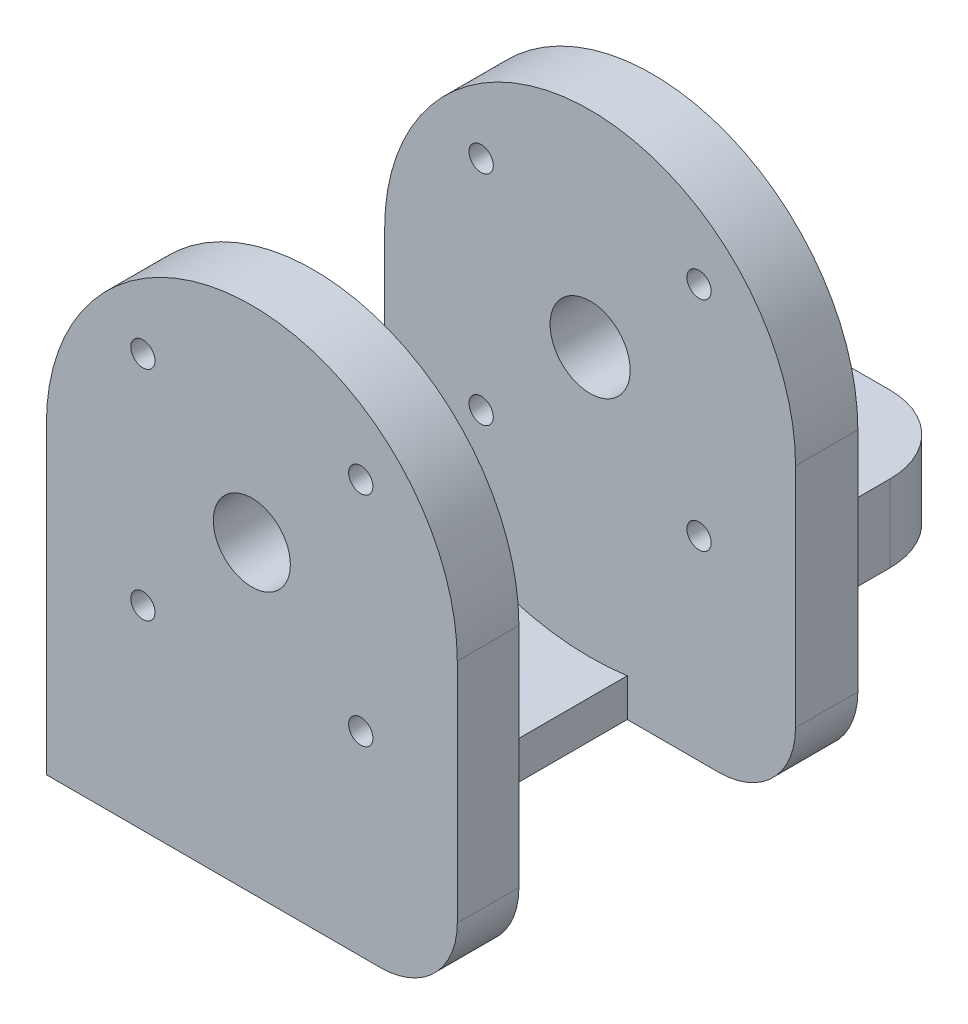
from build123d import *

# Parameters (mm, degrees)
SKETCH1_R                      = 16.934647101
SKETCH1_R_2                    = 1
SKETCH1_R_3                    = 7.5
BOSS_EXTRUDE1_DEPTH            = 5.08
BOSS_EXTRUDE2_START            = -5.08
BOSS_EXTRUDE2_DEPTH            = 5.08
SKETCH3_W                      = 20
SKETCH3_H                      = 6.35
BOSS_EXTRUDE3_DEPTH            = 50.8
BOSS_EXTRUDE4_START            = -25.4
BOSS_EXTRUDE4_DEPTH            = 2.597534174
SKETCH5_R                      = 3.302
CUT_EXTRUDE1_DEPTH             = 50.8
SKETCH6_W                      = 13.869294202
SKETCH6_H                      = 2.597534174
BOSS_EXTRUDE5_DEPTH            = 6.35
CUT_EXTRUDE2_DEPTH             = 50.8
BOSS_EXTRUDE7_START            = 2.54
SKETCH8_R                      = 3.302
BOSS_EXTRUDE7_DEPTH            = 2.54
CUT_EXTRUDE3_REACH             = 55.758
SKETCH10_R                     = 22.133090672
CUT_EXTRUDE3_DIRECTION_2_REACH = 55.758
FILLET1_R                      = 6.35
FILLET3_R                      = 6.35
SKETCH11_R                     = 1
CUT_EXTRUDE4_DEPTH             = 45.770838885
BOSS_EXTRUDE8_START            = -5.08
SKETCH12_R                     = 7.5
SKETCH12_R_2                   = 3.175
BOSS_EXTRUDE8_DEPTH            = 5.08
SKETCH13_W                     = 14.910856388
SKETCH13_H                     = 22.802465826
SKETCH13_W_2                   = 5.089143612
CUT_EXTRUDE5_DEPTH             = 2.54
SKETCH14_W                     = 22.802465826
SKETCH14_H                     = 1.813273425
SKETCH14_H_2                   = 0.683329188
SKETCH14_H_3                   = 3.126670812
CUT_EXTRUDE6_DEPTH             = 2.54


# Read off the part's stored shape, not the designer's step: Boss-Extrude4
with BuildPart() as part:
    # Sketch1 → Boss-Extrude1 (new body)
    with BuildSketch(Plane.XY):
        Circle(SKETCH1_R)
        with Locations((8.980256121, 8.980256121)):
            Circle(SKETCH1_R_2, mode=Mode.SUBTRACT)
        with Locations((8.980256121, -8.980256121)):
            Circle(SKETCH1_R_2, mode=Mode.SUBTRACT)
        with Locations((-8.980256121, -8.980256121)):
            Circle(SKETCH1_R_2, mode=Mode.SUBTRACT)
        with Locations((-8.980256121, 8.980256121)):
            Circle(SKETCH1_R_2, mode=Mode.SUBTRACT)
        Circle(SKETCH1_R_3, mode=Mode.SUBTRACT)
    extrude(amount=BOSS_EXTRUDE1_DEPTH)

    # Sketch2 → Boss-Extrude2 (add)
    with BuildSketch(Plane.XY.offset(5.08).offset(BOSS_EXTRUDE2_START)):
        with BuildLine():
            ThreePointArc((16.934647101, 0), (0, -16.934647101), (-16.934647101, 0))
            Line((-16.934647101, 0), (-16.934647101, -25.046463564))
            Line((-16.934647101, -25.046463564), (16.934647101, -25.046463564))
            Line((16.934647101, -25.046463564), (16.934647101, 0))
        make_face()
    extrude(amount=BOSS_EXTRUDE2_DEPTH)

    # Sketch3 → Boss-Extrude3 (add)
    with BuildSketch(Plane(origin=(0, 0, 0), x_dir=(-1, 0, 0), z_dir=(0, 0, -1))):
        with Locations((6.934647101, -21.871463564)):
            Rectangle(SKETCH3_W, SKETCH3_H)
    extrude(amount=BOSS_EXTRUDE3_DEPTH)

    # Boss-Extrude4 outline → Boss-Extrude4 (add)
    with BuildSketch(Plane.XY.offset(BOSS_EXTRUDE4_START)):
        with BuildLine():
            ThreePointArc((16.934647101, 0), (0, 16.934647101), (-16.934647101, 0))
            Line((-16.934647101, 0), (-16.934647101, -18.696463564))
            Line((-16.934647101, -18.696463564), (16.934647101, -18.696463564))
            Line((16.934647101, -18.696463564), (16.934647101, 0))
        make_face()
    extrude(amount=BOSS_EXTRUDE4_DEPTH)

    # Sketch5 → Cut-Extrude1 (cut)
    with BuildSketch(Plane(origin=(0, 0, -25.4), x_dir=(-1, 0, 0), z_dir=(0, 0, -1))):
        Circle(SKETCH5_R)
    extrude(amount=-CUT_EXTRUDE1_DEPTH, mode=Mode.SUBTRACT)

    # Sketch6 → Boss-Extrude5 (add)
    with BuildSketch(Plane.XZ.offset(18.696463564)):
        with Locations((10, -24.101232913)):
            Rectangle(SKETCH6_W, SKETCH6_H)
    extrude(amount=BOSS_EXTRUDE5_DEPTH)

    # Sketch7 → Cut-Extrude2 (cut)
    with BuildSketch(Plane(origin=(0, -18.696463564, 0), x_dir=(1, 0, 0), z_dir=(0, 1, 0))):
        with BuildLine():
            ThreePointArc((-4.684647101, 11.401232913), (-4.885171568, 12.329753263), (-5.451002692, 13.092770459))
            Line((-5.451002692, 13.092770459), (-8.418291509, 9.709695367))
            ThreePointArc((-8.418291509, 9.709695367), (-6.00612675, 9.35175738), (-4.684647101, 11.401232913))
        make_face()
        with BuildLine():
            Line((-8.418291509, 9.709695367), (-5.451002692, 13.092770459))
            ThreePointArc((-5.451002692, 13.092770459), (-8.626184647, 12.884877321), (-8.418291509, 9.709695367))
        make_face()
        with BuildLine():
            ThreePointArc((-5.542705151, 39.867766276), (-8.702413377, 39.49194195), (-8.32658905, 36.332233724))
            Line((-8.32658905, 36.332233724), (-5.542705151, 39.867766276))
        make_face()
        with BuildLine():
            Line((-5.542705151, 39.867766276), (-8.32658905, 36.332233724))
            ThreePointArc((-8.32658905, 36.332233724), (-5.952142492, 36.075849637), (-4.684647101, 38.1))
            ThreePointArc((-4.684647101, 38.1), (-4.910496737, 39.082504609), (-5.542705151, 39.867766276))
        make_face()
    extrude(amount=-CUT_EXTRUDE2_DEPTH, mode=Mode.SUBTRACT)

    # Sketch8 → Boss-Extrude7 (add)
    with BuildSketch(Plane(origin=(0, 0, -25.4), x_dir=(-1, 0, 0), z_dir=(0, 0, -1)).offset(BOSS_EXTRUDE7_START)):
        with BuildLine():
            Line((-16.934647101, 0), (-16.934647101, -25.046463564))
            Line((-16.934647101, -25.046463564), (-3.065352899, -25.046463564))
            Line((-3.065352899, -25.046463564), (-3.065352899, -18.696463564))
            Line((-3.065352899, -18.696463564), (16.934647101, -18.696463564))
            Line((16.934647101, -18.696463564), (16.934647101, 0))
            ThreePointArc((16.934647101, 0), (0, 16.934647101), (-16.934647101, 0))
        make_face()
        Circle(SKETCH8_R, mode=Mode.SUBTRACT)
    extrude(amount=-BOSS_EXTRUDE7_DEPTH)

    # Cut-Extrude3: up to this face of the body (flat: up to its plane)
    cut_extrude3_end = Plane(part.part.faces().sort_by_distance((0.774222072, -4.051019625, -22.802465826))[0])
    # Sketch10 → Cut-Extrude3 (cut, up to the picked face)
    with BuildSketch(Plane.XY.offset(-6.35), mode=Mode.PRIVATE) as cut_extrude3_sk1:
        Circle(SKETCH10_R)
    cut_extrude3_tool1 = split(extrude(cut_extrude3_sk1.sketch, amount=-CUT_EXTRUDE3_REACH, mode=Mode.PRIVATE), bisect_by=cut_extrude3_end, keep=Keep.BOTH, mode=Mode.PRIVATE)
    add(cut_extrude3_tool1.solids().sort_by(Axis((0, 0, -6.35), (0, 0, -1)))[0], mode=Mode.SUBTRACT)

    # Cut-Extrude3 direction 2: up to this face of the body (flat: up to its plane)
    cut_extrude3_direction_2_end = Plane(part.part.faces().sort_by_distance((16.395245326, -12.523231782, 0))[0])
    # Sketch10 → Cut-Extrude3 direction 2 (cut, up to the picked face)
    with BuildSketch(Plane.XY.offset(-6.35), mode=Mode.PRIVATE) as cut_extrude3_direction_2_sk1:
        Circle(SKETCH10_R)
    cut_extrude3_direction_2_tool1 = split(extrude(cut_extrude3_direction_2_sk1.sketch, amount=CUT_EXTRUDE3_DIRECTION_2_REACH, mode=Mode.PRIVATE), bisect_by=cut_extrude3_direction_2_end, keep=Keep.BOTH, mode=Mode.PRIVATE)
    add(cut_extrude3_direction_2_tool1.solids().sort_by(Axis((0, 0, -6.35), (0, 0, 1)))[0], mode=Mode.SUBTRACT)

    # Fillet1
    fillet1_edges = [part.edges().sort_by_distance(p)[0] for p in [
        (16.934647101, -25.046463564, 2.54),
        (16.934647101, -25.046463564, -25.371232913),
    ]]
    fillet(fillet1_edges, radius=FILLET1_R)

    # Fillet3
    fillet3_edges = [part.edges().sort_by_distance(p)[0] for p in [
        (-16.934647101, -21.871463564, -50.8),
        (3.065352899, -21.871463564, -50.8),
    ]]
    fillet(fillet3_edges, radius=FILLET3_R)

    # Sketch11 → Cut-Extrude4 (cut, through all)
    with BuildSketch(Plane(origin=(0, 0, -27.94), x_dir=(-1, 0, 0), z_dir=(0, 0, -1))):
        with Locations(Location((-8.980256121, -8.980256121, 0), (0, 0, 180))):
            Circle(SKETCH11_R)
        with Locations(Location((-8.980256121, 8.980256121, 0), (0, 0, 180))):
            Circle(SKETCH11_R)
        with Locations(Location((8.980256121, -8.980256121, 0), (0, 0, 180))):
            Circle(SKETCH11_R)
        with Locations(Location((8.980256121, 8.980256121, 0), (0, 0, 180))):
            Circle(SKETCH11_R)
    extrude(amount=-CUT_EXTRUDE4_DEPTH, mode=Mode.SUBTRACT)

    # Sketch12 → Boss-Extrude8 (add)
    with BuildSketch(Plane.XY.offset(5.08).offset(BOSS_EXTRUDE8_START)):
        Circle(SKETCH12_R)
        Circle(SKETCH12_R_2, mode=Mode.SUBTRACT)
    extrude(amount=BOSS_EXTRUDE8_DEPTH)

    # Sketch13 → Cut-Extrude5 (cut)
    with BuildSketch(Plane(origin=(0, -18.696463564, 0), x_dir=(1, 0, 0), z_dir=(0, 1, 0))):
        with Locations((-4.390075295, 11.401232913)):
            Rectangle(SKETCH13_W, SKETCH13_H)
        with Locations((-14.390075295, 11.401232913)):
            Rectangle(SKETCH13_W_2, SKETCH13_H)
    extrude(amount=-CUT_EXTRUDE5_DEPTH, mode=Mode.SUBTRACT)

    # Sketch14 → Cut-Extrude6 (cut)
    with BuildSketch(Plane.ZY.offset(16.934647101)):
        with Locations((-11.401232913, -20.329826852)):
            Rectangle(SKETCH14_W, SKETCH14_H)
        with Locations((-11.401232913, -21.578128158)):
            Rectangle(SKETCH14_W, SKETCH14_H_2)
        with Locations((-11.401232913, -23.483128158)):
            Rectangle(SKETCH14_W, SKETCH14_H_3)
    extrude(amount=-CUT_EXTRUDE6_DEPTH, mode=Mode.SUBTRACT)


solid = part.part
